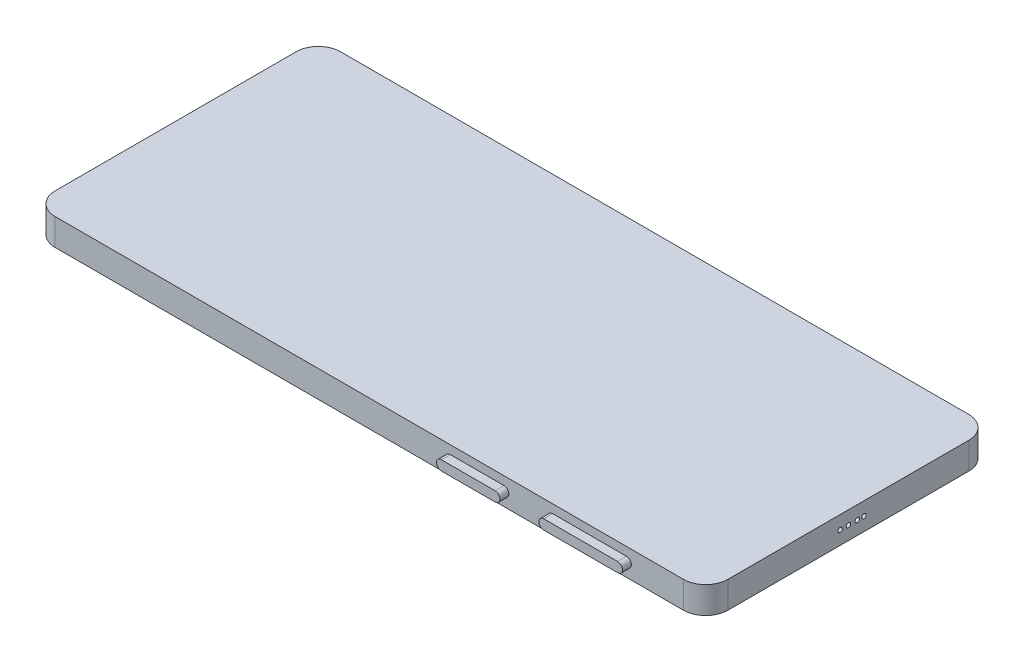
from build123d import *

# Parameters (mm, degrees)
SKETCH_1_W          = 150.689919998
SKETCH_1_H          = 63.936654908
EXTRUDE_1_DEPTH     = 6
FILLET_6_R          = 5
FILLET_7_R          = 5
FILLET_8_R          = 5
FILLET_9_R          = 5
SKETCH_2_W          = 7.93449938
SKETCH_2_H          = 1.809622666
CUT_EXTRUDE_1_DEPTH = 11
SKETCH_3_W          = 6.791001318
SKETCH_3_H          = 0.456984439
EXTRUDE_4_DEPTH     = 10
SKETCH_4_R          = 1
CUT_EXTRUDE_2_DEPTH = 10
SKETCH_7_R          = 0.626407846
EXTRUDE_5_DEPTH     = 5.887149494
SKETCH_11_R         = 0.5
CUT_EXTRUDE_4_DEPTH = 10
SKETCH_12_R         = 23.442239877
EXTRUDE_6_DEPTH     = 3
FILLET_11_R         = 5
EXTRUDE_7_DEPTH     = 2
SKETCH_16_R         = 0.5
CUT_EXTRUDE_5_DEPTH = 7


with BuildPart() as part:
    # 草图1 → 凸台-拉伸1 (new body)
    with BuildSketch(Plane(origin=(0, 0, 0), x_dir=(1, 0, 0), z_dir=(0, 1, 0))):
        with Locations((14.918552812, -2.00585584)):
            Rectangle(SKETCH_1_W, SKETCH_1_H)
    extrude(amount=EXTRUDE_1_DEPTH)

    # 圆角6
    fillet_6_edges = [part.edges().sort_by_distance(p)[0] for p in [
        (90.263512811, 3, -29.962471614),
    ]]
    fillet(fillet_6_edges, radius=FILLET_6_R)

    # 圆角7
    fillet_7_edges = [part.edges().sort_by_distance(p)[0] for p in [
        (90.263512811, 3, 33.974183294),
    ]]
    fillet(fillet_7_edges, radius=FILLET_7_R)

    # 圆角8
    fillet_8_edges = [part.edges().sort_by_distance(p)[0] for p in [
        (-60.426407187, 3, 33.974183294),
    ]]
    fillet(fillet_8_edges, radius=FILLET_8_R)

    # 圆角9
    fillet_9_edges = [part.edges().sort_by_distance(p)[0] for p in [
        (-60.426407187, 3, -29.962471614),
    ]]
    fillet(fillet_9_edges, radius=FILLET_9_R)

    # 草图2 → 切除-拉伸1 (cut)
    with BuildSketch(Plane.ZY.offset(60.426407187)):
        with Locations((1.518649738, 3.03572559)):
            Rectangle(SKETCH_2_W, SKETCH_2_H)
    extrude(amount=-CUT_EXTRUDE_1_DEPTH, mode=Mode.SUBTRACT)

    # 草图3 → 凸台-拉伸4 (add)
    with BuildSketch(Plane.ZY.offset(49.426407187)):
        with Locations((1.631220099, 3.18901263)):
            Rectangle(SKETCH_3_W, SKETCH_3_H)
    extrude(amount=EXTRUDE_4_DEPTH)

    # 草图4 → 切除-拉伸2 (cut)
    with BuildSketch(Plane.ZY.offset(60.426407187)):
        with Locations((13.072394448, 3.110545162)):
            Circle(SKETCH_4_R)
        with Locations((16.065231934, 3.110545162)):
            Circle(SKETCH_4_R)
        with Locations((19.406073778, 3.110545162)):
            Circle(SKETCH_4_R)
        with Locations((22.468512134, 3.110545162)):
            Circle(SKETCH_4_R)
        with Locations((10.079556963, 3.110545162)):
            Circle(SKETCH_4_R)
        with Locations((25.391748748, 3.110545162)):
            Circle(SKETCH_4_R)
    extrude(amount=-CUT_EXTRUDE_2_DEPTH, mode=Mode.SUBTRACT)

    # 草图7 → 凸台-拉伸5 (add)
    with BuildSketch(Plane.ZY.offset(50.426407187)):
        with BuildLine():
            Line((-21.86724317, 4.160702093), (-5.58063918, 4.160702093))
            ThreePointArc((-5.58063918, 4.160702093), (-4.53048225, 3.110545162), (-5.58063918, 2.060388231))
            Line((-5.58063918, 2.060388231), (-21.86724317, 2.060388231))
            ThreePointArc((-21.86724317, 2.060388231), (-22.9174001, 3.110545162), (-21.86724317, 4.160702093))
        make_face()
        with Locations((-21.86724317, 3.110545162)):
            Circle(SKETCH_7_R, mode=Mode.SUBTRACT)
    extrude(amount=EXTRUDE_5_DEPTH)

    # 草图11 → 切除-拉伸4 (cut)
    with BuildSketch(Plane.ZY.offset(60.426407187)):
        with Locations((-22.772054502, 3.417504849)):
            Circle(SKETCH_11_R)
    extrude(amount=-CUT_EXTRUDE_4_DEPTH, mode=Mode.SUBTRACT)

    # 草图12 → 凸台-拉伸6 (add)
    with BuildSketch(Plane.XZ):
        with Locations(Location((58.895102962, 2.00585584, 0), (0, 0, 90))):
            Circle(SKETCH_12_R)
    extrude(amount=EXTRUDE_6_DEPTH)

    # 圆角11
    # the kernel refuses this fillet: 5 mm, written as the material it takes off along each edge
    with BuildSketch(Plane(origin=(58.895102962, -3, 2.00585584), x_dir=(0, 0, 1), z_dir=(1, 0, 0))) as fillet_11_piece_1:
        with BuildLine():
            CenterArc((18.859664182, -5), FILLET_11_R, 23.578178478, 66.421821522)
            Line((18.859664182, 0), (18.859664182, 0.1))
            Line((18.859664182, 0.1), (23.442239877, 0.1))
            Line((23.442239877, 0.1), (23.542239877, 0))
            ThreePointArc((23.542239877, 0), (23.542239877, -1.5), (23.533891391, -2.96))
            Line((23.533891391, -2.96), (23.442239877, -3))
        make_face()
    revolve(axis=Axis((58.895102962, -3, 2.00585584), (0, -1, 0)), mode=Mode.SUBTRACT)

    # 草图15 → 凸台-拉伸7 (add)
    with BuildSketch(Plane.XY.offset(33.974183294)):
        with BuildLine():
            Line((72.53746341, 1.907291866), (56.006132514, 1.907291866))
            ThreePointArc((56.006132514, 1.907291866), (54.91342438, 3), (56.006132514, 4.092708134))
            Line((56.006132514, 4.092708134), (72.53746341, 4.092708134))
            ThreePointArc((72.53746341, 4.092708134), (73.630171544, 3), (72.53746341, 1.907291866))
        make_face()
        with BuildLine():
            Line((45.092244156, 1.907291866), (33.05486729, 1.907291866))
            ThreePointArc((33.05486729, 1.907291866), (31.962159155, 3), (33.05486729, 4.092708134))
            Line((33.05486729, 4.092708134), (45.092244156, 4.092708134))
            ThreePointArc((45.092244156, 4.092708134), (46.18495229, 3), (45.092244156, 1.907291866))
        make_face()
    extrude(amount=EXTRUDE_7_DEPTH)

    # 草图16 → 切除-拉伸5 (cut)
    with BuildSketch(Plane(origin=(90.263512811, 0, 0), x_dir=(0, 0, -1), z_dir=(1, 0, 0))):
        with Locations((0, 3)):
            Circle(SKETCH_16_R)
        with Locations((1.488767231, 3)):
            Circle(SKETCH_16_R)
        with Locations((-2.00585584, 3)):
            Circle(SKETCH_16_R)
        with Locations((-3.848597666, 3)):
            Circle(SKETCH_16_R)
    extrude(amount=-CUT_EXTRUDE_5_DEPTH, mode=Mode.SUBTRACT)


solid = part.part
